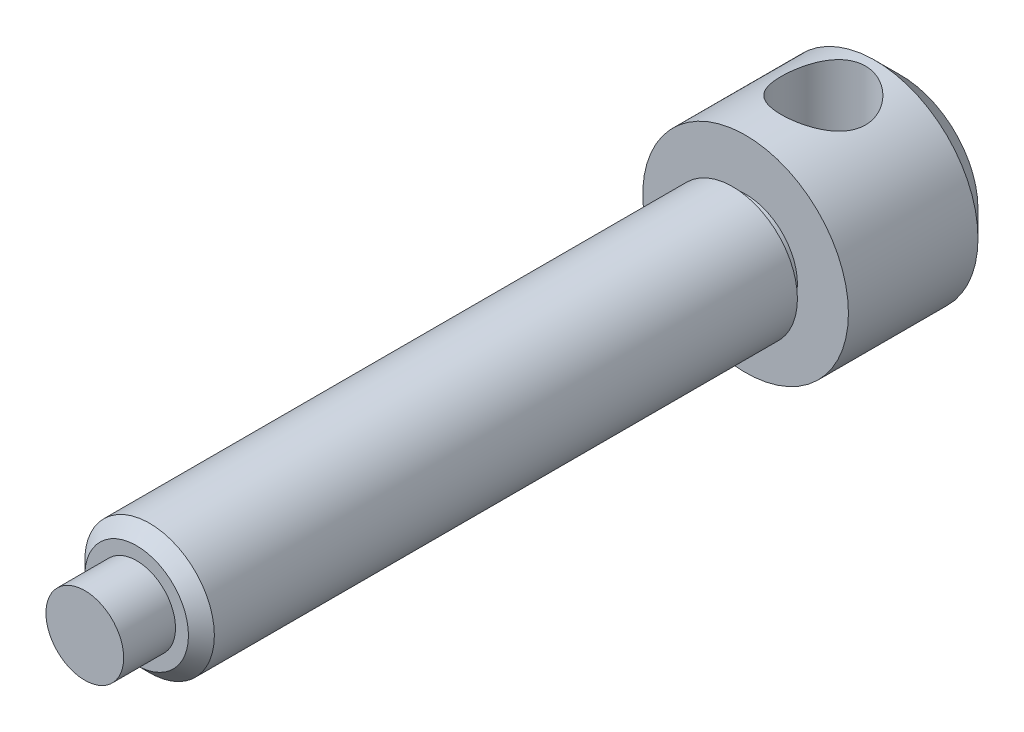
from build123d import *

# Parameters (mm, degrees)
ESBO_O1_R                  = 7.9375
RESSALTO_EXTRUS_O1_DEPTH   = 12
ESBO_O2_R                  = 4
RESSALTO_EXTRUS_O2_DEPTH   = 1
ESBO_O3_R                  = 5
RESSALTO_EXTRUS_O3_DEPTH   = 46
ESBO_O4_R                  = 3
RESSALTO_EXTRUS_O4_DEPTH   = 4
CORTE_EXTRUS_O1_DEPTH      = 64.992248066
CORTE_EXTRUS_O1_DEPTH_BACK = 64.992248066
ESBO_O5_R                  = 3.25
CHANFRO1_SIZE              = 2
CHANFRO2_SIZE              = 1


with BuildPart() as part:
    # Esboço1 → Ressalto-extrusão1 (new body)
    with BuildSketch(Plane.XY):
        Circle(ESBO_O1_R)
    extrude(amount=RESSALTO_EXTRUS_O1_DEPTH)

    # Esboço2 → Ressalto-extrusão2 (add)
    with BuildSketch(Plane.XY.offset(12)):
        Circle(ESBO_O2_R)
    extrude(amount=RESSALTO_EXTRUS_O2_DEPTH)

    # Esboço3 → Ressalto-extrusão3 (add)
    with BuildSketch(Plane.XY.offset(13)):
        Circle(ESBO_O3_R)
    extrude(amount=RESSALTO_EXTRUS_O3_DEPTH)

    # Esboço4 → Ressalto-extrusão4 (add)
    with BuildSketch(Plane.XY.offset(59)):
        Circle(ESBO_O4_R)
    extrude(amount=RESSALTO_EXTRUS_O4_DEPTH)

    # Esboço5 → Corte-extrusão1 (cut, two sides: drawn at the far end of the back side and taken through both)
    with BuildSketch(Plane(origin=(0, 0, 0), x_dir=(1, 0, 0), z_dir=(0, 1, 0)).offset(-CORTE_EXTRUS_O1_DEPTH_BACK)):
        with Locations((0, -6)):
            Circle(ESBO_O5_R)
    extrude(amount=CORTE_EXTRUS_O1_DEPTH + CORTE_EXTRUS_O1_DEPTH_BACK, mode=Mode.SUBTRACT)

    # Chanfro1
    chanfro1_edges = [part.edges().sort_by_distance(p)[0] for p in [
        (-7.9375, 0, 0),
    ]]
    chamfer(chanfro1_edges, length=CHANFRO1_SIZE)

    # Chanfro2
    chanfro2_edges = [part.edges().sort_by_distance(p)[0] for p in [
        (-5, 0, 59),
    ]]
    chamfer(chanfro2_edges, length=CHANFRO2_SIZE)


solid = part.part
